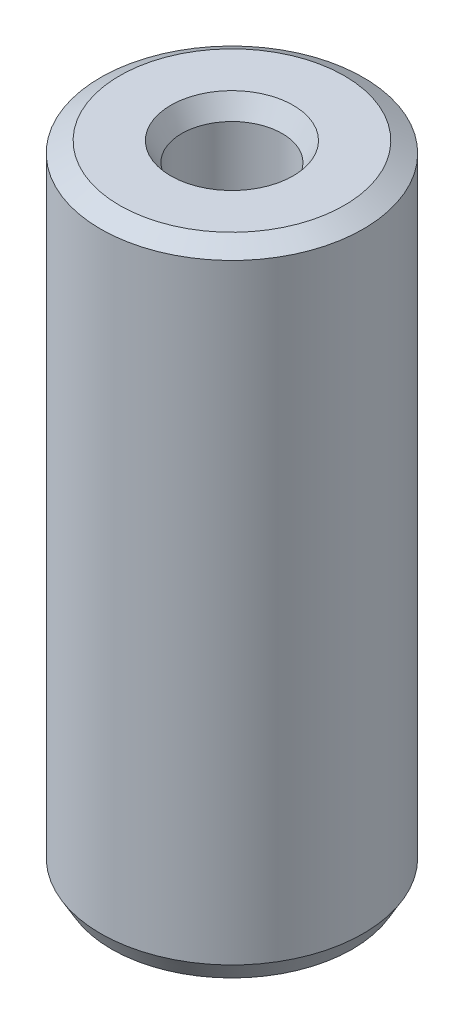
from build123d import *
from OCP.BRepFilletAPI import BRepFilletAPI_MakeChamfer

# Parameters (mm, degrees)
SKETCH1_R           = 32.5
BOSS_EXTRUDE1_DEPTH = 158.386331226
SKETCH2_R           = 12.434014016
CUT_EXTRUDE1_DEPTH  = 165.920374482
CHAMFER1_SIZE       = 2.714733872
CHAMFER1_SIZE2      = 4.702056996


with BuildPart() as part:
    # Sketch1 → Boss-Extrude1 (new body)
    with BuildSketch(Plane(origin=(0, 0, 0), x_dir=(1, 0, 0), z_dir=(0, 1, 0))):
        Circle(SKETCH1_R)
    extrude(amount=BOSS_EXTRUDE1_DEPTH)

    # Sketch2 → Cut-Extrude1 (cut, through all)
    with BuildSketch(Plane(origin=(0, 0, 0), x_dir=(1, 0, 0), z_dir=(0, 1, 0))):
        Circle(SKETCH2_R)
    extrude(amount=CUT_EXTRUDE1_DEPTH, mode=Mode.SUBTRACT)

    # Chamfer1: one chamfer whose edges measure the first distance from different faces: ONE call of the kernel's chamfer builder (chamfer() names one face for all edges)
    chamfer1_edges_1 = [part.edges().sort_by_distance(p)[0] for p in [
        (-12.434014016, 158.386331226, 0),
    ]]
    chamfer1_side_1 = [part.faces().sort_by_distance(p)[0] for p in [
        (-31.580761184, 158.386331226, 0),
    ]]
    chamfer1_edges_2 = [part.edges().sort_by_distance(p)[0] for p in [
        (-12.434014016, 0, 0),
    ]]
    chamfer1_side_2 = [part.faces().sort_by_distance(p)[0] for p in [
        (-12.434014016, 79.193165613, 0),
    ]]
    chamfer1_edges_3 = [part.edges().sort_by_distance(p)[0] for p in [
        (-32.5, 0, 0),
    ]]
    chamfer1_side_3 = [part.faces().sort_by_distance(p)[0] for p in [
        (-31.580761184, 0, 0),
    ]]
    chamfer1_edges_4 = [part.edges().sort_by_distance(p)[0] for p in [
        (-32.5, 158.386331226, 0),
    ]]
    chamfer1_side_4 = [part.faces().sort_by_distance(p)[0] for p in [
        (-32.5, 79.193165613, 0),
    ]]
    chamfer1 = BRepFilletAPI_MakeChamfer(part.part.solid().wrapped)
    for e in chamfer1_edges_1:
        chamfer1.Add(CHAMFER1_SIZE, CHAMFER1_SIZE2, e.wrapped, chamfer1_side_1[0].wrapped)  # the first distance lies on this face
    for e in chamfer1_edges_2:
        chamfer1.Add(CHAMFER1_SIZE, CHAMFER1_SIZE2, e.wrapped, chamfer1_side_2[0].wrapped)  # the first distance lies on this face
    for e in chamfer1_edges_3:
        chamfer1.Add(CHAMFER1_SIZE, CHAMFER1_SIZE2, e.wrapped, chamfer1_side_3[0].wrapped)  # the first distance lies on this face
    for e in chamfer1_edges_4:
        chamfer1.Add(CHAMFER1_SIZE, CHAMFER1_SIZE2, e.wrapped, chamfer1_side_4[0].wrapped)  # the first distance lies on this face
    add(Compound.cast(chamfer1.Shape()), mode=Mode.REPLACE)


solid = part.part
